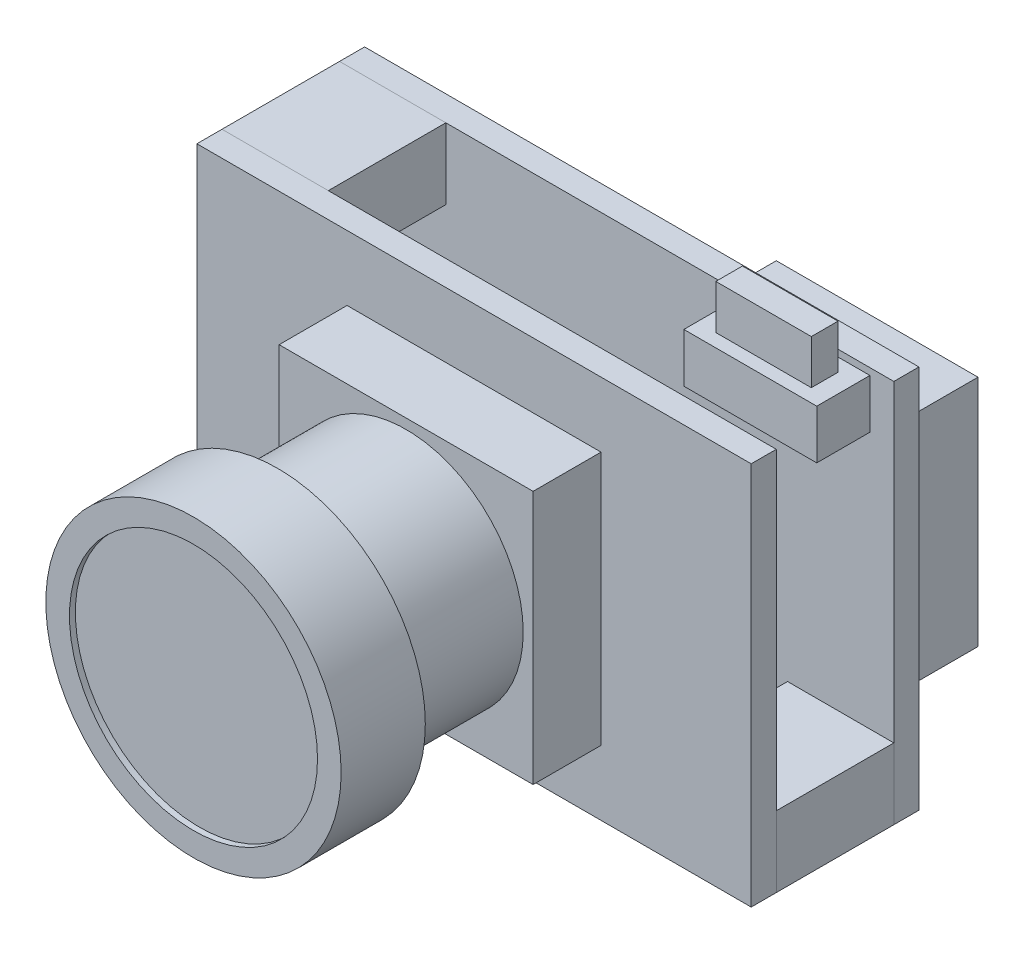
from build123d import *

# Parameters (mm, degrees)
SKETCH1_W             = 18.77
SKETCH1_H             = 13
BOSS_EXTRUDE1_DEPTH   = 0.85
SKETCH2_W             = 3.6
SKETCH2_H             = 2.4
BOSS_EXTRUDE2_DEPTH   = 3.98
BOSS_EXTRUDE2_2_DEPTH = 3.98
SKETCH3_W             = 18.77
SKETCH3_H             = 13
BOSS_EXTRUDE3_DEPTH   = 0.85
SKETCH4_W             = 8.6
SKETCH4_H             = 8.6
BOSS_EXTRUDE4_DEPTH   = 2.3
SKETCH5_R             = 3.965
BOSS_EXTRUDE5_DEPTH   = 4.35
SKETCH6_R             = 5
BOSS_EXTRUDE6_DEPTH   = 2.85
SKETCH7_R             = 4.2
CUT_EXTRUDE1_DEPTH    = 0.2
SKETCH8_W             = 6.83
SKETCH8_H             = 7.9
BOSS_EXTRUDE7_DEPTH   = 2.3
SKETCH9_W             = 6
SKETCH9_H             = 6
BOSS_EXTRUDE8_DEPTH   = 1
SKETCH10_W            = 4.5
SKETCH10_H            = 1.66423566
BOSS_EXTRUDE9_DEPTH   = 1.8
SKETCH11_W            = 3.234818436
SKETCH11_H            = 0.902158146
BOSS_EXTRUDE10_DEPTH  = 1.5
SKETCH12_W            = 2.417880197
SKETCH12_H            = 2.29029457
BOSS_EXTRUDE11_DEPTH  = 1.5
SKETCH13_R            = 0.45
BOSS_EXTRUDE13_DEPTH  = 4


with BuildPart() as part:
    # Sketch1 → Boss-Extrude1 (new body)
    with BuildSketch(Plane.XY):
        Rectangle(SKETCH1_W, SKETCH1_H)
    extrude(amount=BOSS_EXTRUDE1_DEPTH)

    # Sketch8 → Boss-Extrude7 (add)
    with BuildSketch(Plane(origin=(0, 0, 0), x_dir=(-1, 0, 0), z_dir=(0, 0, -1))):
        with Locations((-5.67, 0.95)):
            Rectangle(SKETCH8_W, SKETCH8_H)
    extrude(amount=BOSS_EXTRUDE7_DEPTH)

    # Sketch9 → Boss-Extrude8 (add)
    with BuildSketch(Plane(origin=(0, 0, 0), x_dir=(-1, 0, 0), z_dir=(0, 0, -1))):
        with Locations((2.351912758, -2.176373759)):
            Rectangle(SKETCH9_W, SKETCH9_H)
    extrude(amount=BOSS_EXTRUDE8_DEPTH)

    # Sketch10 → Boss-Extrude9 (add)
    with BuildSketch(Plane.XY.offset(0.85)):
        with Locations((6.324850122, 5.437990757)):
            Rectangle(SKETCH10_W, SKETCH10_H)
    extrude(amount=BOSS_EXTRUDE9_DEPTH)

    # Sketch11 → Boss-Extrude10 (add)
    with BuildSketch(Plane(origin=(0, 6.270108587, 0), x_dir=(1, 0, 0), z_dir=(0, 1, 0))):
        with Locations((6.324850122, -1.75)):
            Rectangle(SKETCH11_W, SKETCH11_H)
    extrude(amount=BOSS_EXTRUDE10_DEPTH)

    # Sketch12 → Boss-Extrude11 (add)
    with BuildSketch(Plane.XY.offset(0.85)):
        with Locations((-4.872863027, 0)):
            Rectangle(SKETCH12_W, SKETCH12_H)
    extrude(amount=BOSS_EXTRUDE11_DEPTH)

    # Sketch13 → Boss-Extrude13 (add)
    with BuildSketch(Plane.ZY.offset(6.081803125)):
        with Locations((1.6, 0.55)):
            Circle(SKETCH13_R)
        with Locations((1.6, -0.55)):
            Circle(SKETCH13_R)
    extrude(amount=BOSS_EXTRUDE13_DEPTH)


with BuildPart() as body_2:
    # Sketch2 → Boss-Extrude2 (new body)
    with BuildSketch(Plane.XY.offset(0.85)):
        with Locations((7.585, -5.3)):
            Rectangle(SKETCH2_W, SKETCH2_H)
    extrude(amount=BOSS_EXTRUDE2_DEPTH)


with BuildPart() as body_3:
    # Sketch2 → Boss-Extrude2 2 (new body)
    with BuildSketch(Plane.XY.offset(0.85)):
        with Locations((-7.585, 5.3)):
            Rectangle(SKETCH2_W, SKETCH2_H)
    extrude(amount=BOSS_EXTRUDE2_2_DEPTH)


with BuildPart() as body_4:
    # Sketch3 → Boss-Extrude3 (new body)
    with BuildSketch(Plane.XY.offset(4.83)):
        Rectangle(SKETCH3_W, SKETCH3_H)
    extrude(amount=BOSS_EXTRUDE3_DEPTH)


with BuildPart() as body_5:
    # Sketch4 → Boss-Extrude4 (new body)
    with BuildSketch(Plane.XY.offset(5.68)):
        Rectangle(SKETCH4_W, SKETCH4_H)
    extrude(amount=BOSS_EXTRUDE4_DEPTH)


with BuildPart() as body_6:
    # Sketch5 → Boss-Extrude5 (new body)
    with BuildSketch(Plane.XY.offset(7.98)):
        Circle(SKETCH5_R)
    extrude(amount=BOSS_EXTRUDE5_DEPTH)


with BuildPart() as body_7:
    # Sketch6 → Boss-Extrude6 (new body)
    with BuildSketch(Plane.XY.offset(12.33)):
        Circle(SKETCH6_R)
    extrude(amount=BOSS_EXTRUDE6_DEPTH)

    # Sketch7 → Cut-Extrude1 (cut)
    with BuildSketch(Plane.XY.offset(15.18)):
        Circle(SKETCH7_R)
    extrude(amount=-CUT_EXTRUDE1_DEPTH, mode=Mode.SUBTRACT)


solid = Compound([part.part, body_2.part, body_3.part, body_4.part, body_5.part, body_6.part, body_7.part])
